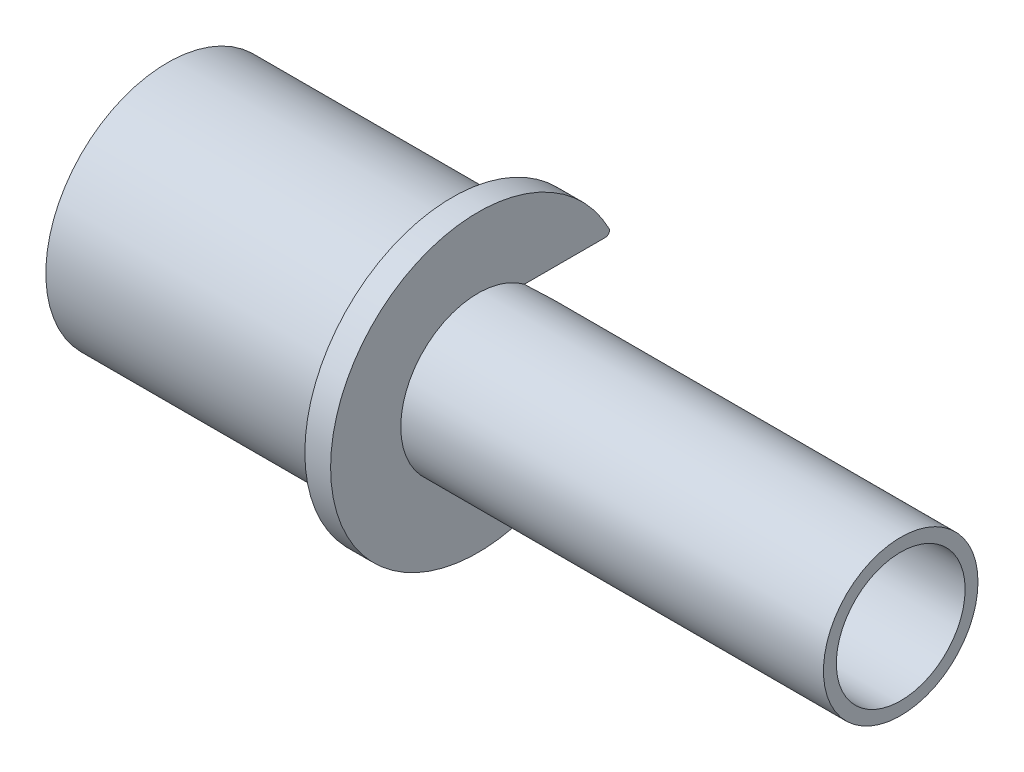
from build123d import *

# Parameters (mm, degrees)
CUT_EXTRUDE2_REACH = 46.832
FILLET1_R          = 0.254


with BuildPart() as part:
    # Sketch1 → Revolve1 (revolve)
    with BuildSketch(Plane.XY):
        Polygon((2.2375, 3.96875), (2.2375, 4.7625), (-23.8125, 4.7625), (-23.8125, 9.087499986), (-25.4, 9.087499986), (-25.4, 7.499999986), (-42.95, 7.499999986), (-42.95, 3.96875), align=None)
    revolve(axis=Axis((0, 0, 0), (-1, 0, 0)))

    # Sketch3 → Cut-Extrude2 (cut, up to next)
    with BuildSketch(Plane.XY, mode=Mode.PRIVATE) as cut_extrude2_sk1:
        with BuildLine():
            Line((-42.95, 3.81), (-42.95, -3.81))
            Line((-42.95, -3.81), (-23.8125, -3.81))
            ThreePointArc((-23.8125, -3.81), (-21.56743597, -2.88006403), (-20.6375, -0.635))
            Line((-20.6375, -0.635), (-20.6375, 0.635))
            ThreePointArc((-20.6375, 0.635), (-21.56743597, 2.88006403), (-23.8125, 3.81))
            Line((-23.8125, 3.81), (-42.95, 3.81))
        make_face()
    cut_extrude2_tool1 = extrude(cut_extrude2_sk1.sketch, amount=-CUT_EXTRUDE2_REACH, mode=Mode.PRIVATE) & part.part
    add(cut_extrude2_tool1.solids().sort_by_distance((-32.066545, 0, 0))[0], mode=Mode.SUBTRACT)

    # Fillet1
    fillet1_edges = [part.edges().sort_by_distance(p)[0] for p in [
        (-24.60625, 3.81, -8.250245814),
        (-24.60625, -3.81, -8.250245814),
        (-34.175, -3.81, -6.460178),
        (-34.175, 3.81, -6.460178),
    ]]
    fillet(fillet1_edges, radius=FILLET1_R)


solid = part.part
